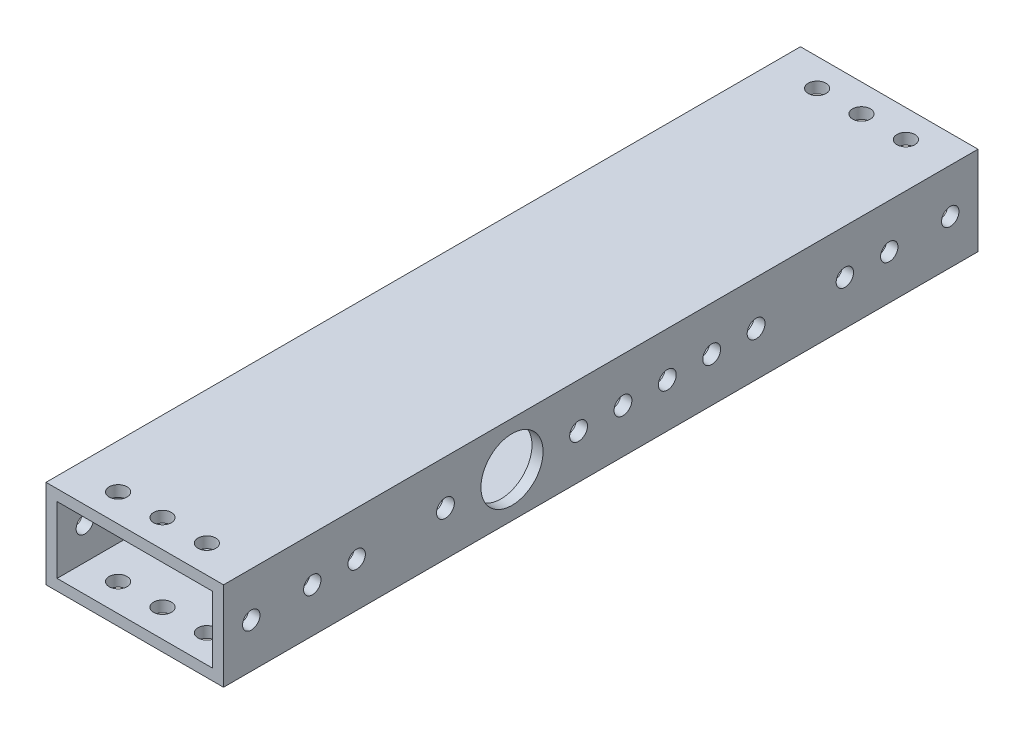
from build123d import *

# Parameters (mm, degrees)
SKETCH1_W           = 50.8
SKETCH1_H           = 25.4
SKETCH1_W_2         = 44.45
SKETCH1_H_2         = 19.05
BOSS_EXTRUDE1_DEPTH = 107.95
SKETCH3_R           = 2.5527
CUT_EXTRUDE2_DEPTH  = 114.769602707
SKETCH4_R           = 8.89
SKETCH4_R_2         = 2.5527
CUT_EXTRUDE3_DEPTH  = 120.979717036
SKETCH2_R           = 2.4892
CUT_EXTRUDE1_DEPTH  = 120.979717036
CUT_EXTRUDE4_REACH  = 115.77
SKETCH5_R           = 2.4892
CUT_EXTRUDE5_REACH  = 121.98
SKETCH7_R           = 2.5527


with BuildPart() as part:
    # Sketch1 → Boss-Extrude1 (new, symmetric)
    with BuildSketch(Plane.XY):
        Rectangle(SKETCH1_W, SKETCH1_H)
        Rectangle(SKETCH1_W_2, SKETCH1_H_2, mode=Mode.SUBTRACT)
    extrude(amount=BOSS_EXTRUDE1_DEPTH, both=True)

    # Sketch3 → Cut-Extrude2 (cut, through all)
    with BuildSketch(Plane(origin=(0, 12.7, 0), x_dir=(1, 0, 0), z_dir=(0, 1, 0))):
        with Locations((-12.7, -100.0125)):
            Circle(SKETCH3_R)
        with Locations((0, -100.0125)):
            Circle(SKETCH3_R)
        with Locations((12.7, -100.0125)):
            Circle(SKETCH3_R)
        with Locations((12.7, 100.0125)):
            Circle(SKETCH3_R)
        with Locations((0, 100.0125)):
            Circle(SKETCH3_R)
        with Locations((-12.7, 100.0125)):
            Circle(SKETCH3_R)
    extrude(amount=-CUT_EXTRUDE2_DEPTH, mode=Mode.SUBTRACT)

    # Sketch4 → Cut-Extrude3 (cut, through all)
    with BuildSketch(Plane(origin=(25.4, 0, 0), x_dir=(0, 0, -1), z_dir=(1, 0, 0))):
        with Locations((-25.4, 0)):
            Circle(SKETCH4_R)
        with Locations((31.75, 0)):
            Circle(SKETCH4_R_2)
        with Locations((19.05, 0)):
            Circle(SKETCH4_R_2)
    extrude(amount=-CUT_EXTRUDE3_DEPTH, mode=Mode.SUBTRACT)

    # Sketch2 → Cut-Extrude1 (cut, through all)
    with BuildSketch(Plane(origin=(25.4, 0, 0), x_dir=(0, 0, -1), z_dir=(1, 0, 0))):
        with Locations((-100.0125, 0)):
            Circle(SKETCH2_R)
        with Locations((100.0125, 0)):
            Circle(SKETCH2_R)
        with Locations((-82.55, 0)):
            Circle(SKETCH2_R)
        with Locations((-69.85, 0)):
            Circle(SKETCH2_R)
        with Locations((69.85, 0)):
            Circle(SKETCH2_R)
        with Locations((82.55, 0)):
            Circle(SKETCH2_R)
    extrude(amount=-CUT_EXTRUDE1_DEPTH, mode=Mode.SUBTRACT)

    # Sketch5 → Cut-Extrude4 (cut, up to next)
    with BuildSketch(Plane.XZ.offset(12.7), mode=Mode.PRIVATE) as cut_extrude4_sk1:
        with Locations((-3.81, 69.85)):
            Circle(SKETCH5_R)
    cut_extrude4_tool1 = extrude(cut_extrude4_sk1.sketch, amount=-CUT_EXTRUDE4_REACH, mode=Mode.PRIVATE) & part.part
    # Sketch5 → Cut-Extrude4 (cut, up to next)
    with BuildSketch(Plane.XZ.offset(12.7), mode=Mode.PRIVATE) as cut_extrude4_sk2:
        with Locations((-16.51, 69.85)):
            Circle(SKETCH5_R)
    cut_extrude4_tool2 = extrude(cut_extrude4_sk2.sketch, amount=-CUT_EXTRUDE4_REACH, mode=Mode.PRIVATE) & part.part
    # Sketch5 → Cut-Extrude4 (cut, up to next)
    with BuildSketch(Plane.XZ.offset(12.7), mode=Mode.PRIVATE) as cut_extrude4_sk3:
        with Locations((-16.51, 57.15)):
            Circle(SKETCH5_R)
    cut_extrude4_tool3 = extrude(cut_extrude4_sk3.sketch, amount=-CUT_EXTRUDE4_REACH, mode=Mode.PRIVATE) & part.part
    # Sketch5 → Cut-Extrude4 (cut, up to next)
    with BuildSketch(Plane.XZ.offset(12.7), mode=Mode.PRIVATE) as cut_extrude4_sk4:
        with Locations((-3.81, 57.15)):
            Circle(SKETCH5_R)
    cut_extrude4_tool4 = extrude(cut_extrude4_sk4.sketch, amount=-CUT_EXTRUDE4_REACH, mode=Mode.PRIVATE) & part.part
    # Sketch5 → Cut-Extrude4 (cut, up to next)
    with BuildSketch(Plane.XZ.offset(12.7), mode=Mode.PRIVATE) as cut_extrude4_sk5:
        with Locations((-3.81, -6.35)):
            Circle(SKETCH5_R)
    cut_extrude4_tool5 = extrude(cut_extrude4_sk5.sketch, amount=-CUT_EXTRUDE4_REACH, mode=Mode.PRIVATE) & part.part
    # Sketch5 → Cut-Extrude4 (cut, up to next)
    with BuildSketch(Plane.XZ.offset(12.7), mode=Mode.PRIVATE) as cut_extrude4_sk6:
        with Locations((-16.51, -6.35)):
            Circle(SKETCH5_R)
    cut_extrude4_tool6 = extrude(cut_extrude4_sk6.sketch, amount=-CUT_EXTRUDE4_REACH, mode=Mode.PRIVATE) & part.part
    # Sketch5 → Cut-Extrude4 (cut, up to next)
    with BuildSketch(Plane.XZ.offset(12.7), mode=Mode.PRIVATE) as cut_extrude4_sk7:
        with Locations((-16.51, -19.05)):
            Circle(SKETCH5_R)
    cut_extrude4_tool7 = extrude(cut_extrude4_sk7.sketch, amount=-CUT_EXTRUDE4_REACH, mode=Mode.PRIVATE) & part.part
    # Sketch5 → Cut-Extrude4 (cut, up to next)
    with BuildSketch(Plane.XZ.offset(12.7), mode=Mode.PRIVATE) as cut_extrude4_sk8:
        with Locations((-3.81, -19.05)):
            Circle(SKETCH5_R)
    cut_extrude4_tool8 = extrude(cut_extrude4_sk8.sketch, amount=-CUT_EXTRUDE4_REACH, mode=Mode.PRIVATE) & part.part
    add(cut_extrude4_tool1.solids().sort_by_distance((-3.81, -12.7, 69.85))[0], mode=Mode.SUBTRACT)
    add(cut_extrude4_tool2.solids().sort_by_distance((-16.51, -12.7, 69.85))[0], mode=Mode.SUBTRACT)
    add(cut_extrude4_tool3.solids().sort_by_distance((-16.51, -12.7, 57.15))[0], mode=Mode.SUBTRACT)
    add(cut_extrude4_tool4.solids().sort_by_distance((-3.81, -12.7, 57.15))[0], mode=Mode.SUBTRACT)
    add(cut_extrude4_tool5.solids().sort_by_distance((-3.81, -12.7, -6.35))[0], mode=Mode.SUBTRACT)
    add(cut_extrude4_tool6.solids().sort_by_distance((-16.51, -12.7, -6.35))[0], mode=Mode.SUBTRACT)
    add(cut_extrude4_tool7.solids().sort_by_distance((-16.51, -12.7, -19.05))[0], mode=Mode.SUBTRACT)
    add(cut_extrude4_tool8.solids().sort_by_distance((-3.81, -12.7, -19.05))[0], mode=Mode.SUBTRACT)

    # Sketch7 → Cut-Extrude5 (cut, up to next)
    with BuildSketch(Plane(origin=(25.4, 0, 0), x_dir=(0, 0, -1), z_dir=(1, 0, 0)), mode=Mode.PRIVATE) as cut_extrude5_sk1:
        with Locations((44.45, 0)):
            Circle(SKETCH7_R)
    cut_extrude5_tool1 = extrude(cut_extrude5_sk1.sketch, amount=-CUT_EXTRUDE5_REACH, mode=Mode.PRIVATE) & part.part
    # Sketch7 → Cut-Extrude5 (cut, up to next)
    with BuildSketch(Plane(origin=(25.4, 0, 0), x_dir=(0, 0, -1), z_dir=(1, 0, 0)), mode=Mode.PRIVATE) as cut_extrude5_sk2:
        with Locations((6.35, 0)):
            Circle(SKETCH7_R)
    cut_extrude5_tool2 = extrude(cut_extrude5_sk2.sketch, amount=-CUT_EXTRUDE5_REACH, mode=Mode.PRIVATE) & part.part
    # Sketch7 → Cut-Extrude5 (cut, up to next)
    with BuildSketch(Plane(origin=(25.4, 0, 0), x_dir=(0, 0, -1), z_dir=(1, 0, 0)), mode=Mode.PRIVATE) as cut_extrude5_sk3:
        with Locations((-6.35, 0)):
            Circle(SKETCH7_R)
    cut_extrude5_tool3 = extrude(cut_extrude5_sk3.sketch, amount=-CUT_EXTRUDE5_REACH, mode=Mode.PRIVATE) & part.part
    # Sketch7 → Cut-Extrude5 (cut, up to next)
    with BuildSketch(Plane(origin=(25.4, 0, 0), x_dir=(0, 0, -1), z_dir=(1, 0, 0)), mode=Mode.PRIVATE) as cut_extrude5_sk4:
        with Locations((-44.45, 0)):
            Circle(SKETCH7_R)
    cut_extrude5_tool4 = extrude(cut_extrude5_sk4.sketch, amount=-CUT_EXTRUDE5_REACH, mode=Mode.PRIVATE) & part.part
    add(cut_extrude5_tool1.solids().sort_by_distance((25.4, 0, -44.45))[0], mode=Mode.SUBTRACT)
    add(cut_extrude5_tool2.solids().sort_by_distance((25.4, 0, -6.35))[0], mode=Mode.SUBTRACT)
    add(cut_extrude5_tool3.solids().sort_by_distance((25.4, 0, 6.35))[0], mode=Mode.SUBTRACT)
    add(cut_extrude5_tool4.solids().sort_by_distance((25.4, 0, 44.45))[0], mode=Mode.SUBTRACT)


solid = part.part
